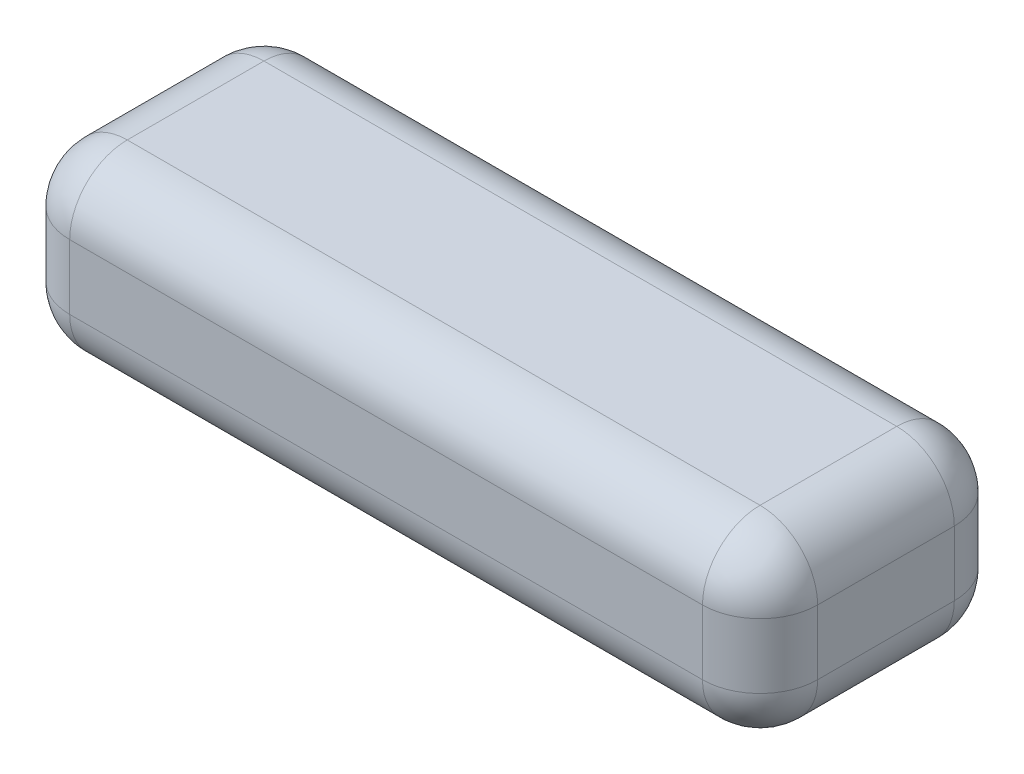
from build123d import *

# Parameters (mm, degrees)
SKETCH1_W           = 103.95
SKETCH1_H           = 35
BOSS_EXTRUDE1_DEPTH = 25
FILLET1_R           = 8


with BuildPart() as part:
    # Sketch1 → Boss-Extrude1 (new body)
    with BuildSketch(Plane(origin=(0, 0, 0), x_dir=(1, 0, 0), z_dir=(0, 1, 0))):
        Rectangle(SKETCH1_W, SKETCH1_H)
    extrude(amount=BOSS_EXTRUDE1_DEPTH)

    # Fillet1
    fillet1_edges = [part.edges().sort_by_distance(p)[0] for p in [
        (-51.975, 0, 0),
        (51.975, 0, 0),
        (51.975, 12.5, -17.5),
        (-51.975, 12.5, -17.5),
        (0, 0, -17.5),
        (-51.975, 12.5, 17.5),
        (51.975, 12.5, 17.5),
        (0, 0, 17.5),
        (0, 25, 17.5),
        (-51.975, 25, 0),
        (0, 25, -17.5),
        (51.975, 25, 0),
    ]]
    fillet(fillet1_edges, radius=FILLET1_R)


solid = part.part
